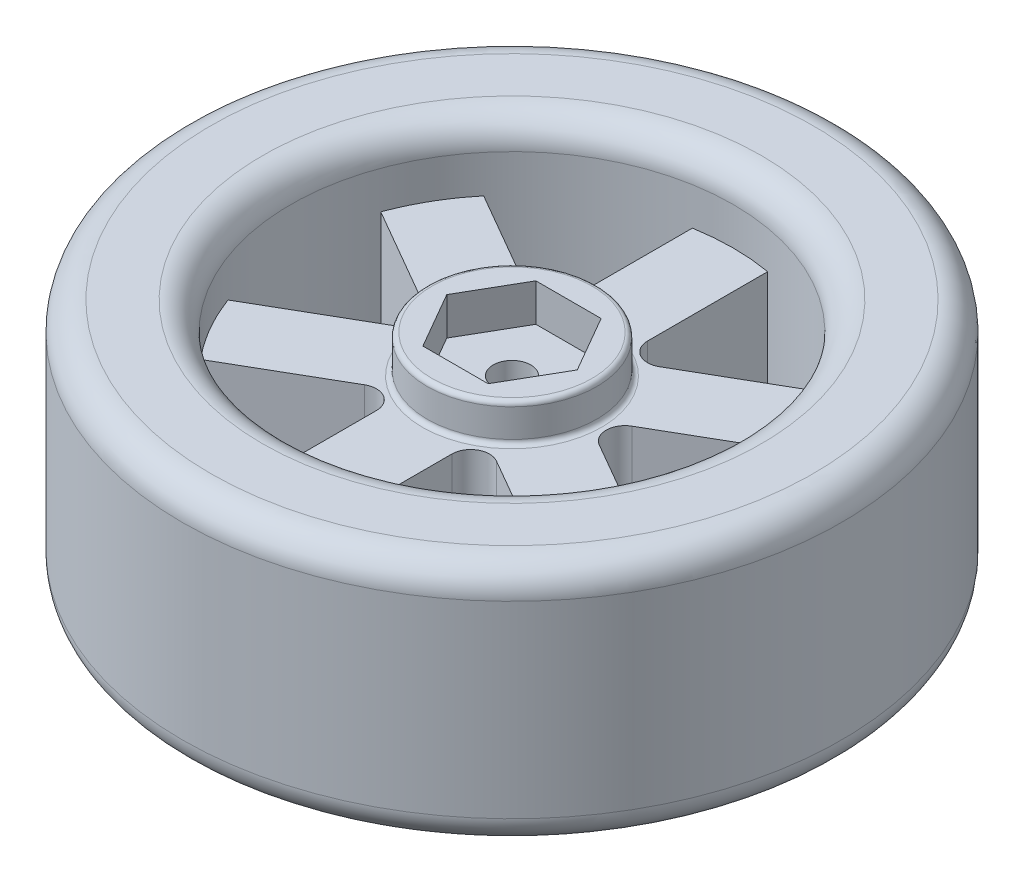
from build123d import *

# Parameters (mm, degrees)
EXTRUDE_1_DEPTH         = 19
SKETCH_2_R              = 35
SKETCH_2_R_2            = 23.501
EXTRUDE_2_DEPTH         = 26
SKETCH_3_R              = 9
EXTRUDE_3_DEPTH         = 4
SKETCH_4_R              = 2
CUT_EXTRUDE_1_DEPTH     = 54.018864567
CUT_EXTRUDE_2_OUTLINE_R = 2
CUT_EXTRUDE_2_DEPTH     = 3
FILLET_1_R              = 3
FILLET_2_R              = 2
FILLET_4_R              = 0.5


# Read off the part's stored shape, not the designer's step: 凸台-拉伸1, 切除-拉伸2
with BuildPart() as part:
    # 凸台-拉伸1 outline → 凸台-拉伸1 (new body)
    with BuildSketch(Plane(origin=(0, 0, 0), x_dir=(1, 0, 0), z_dir=(0, 1, 0))):
        with BuildLine():
            ThreePointArc((-22.052987429, -8.113836459), (-20.349816777, -11.749329428), (-18.052692611, -15.041869475))
            Line((-18.052692611, -15.041869475), (-3.998719808, -6.927804495))
            Line((-3.998719808, -6.927804495), (-3.998719808, -23.155535764))
            ThreePointArc((-3.998719808, -23.155535764), (0.001294785, -23.498293197), (4.001280192, -23.155195337))
            Line((4.001280192, -23.155195337), (4.001280192, -6.927065376))
            Line((4.001280192, -6.927065376), (18.054907717, -15.04093101))
            ThreePointArc((18.054907717, -15.04093101), (20.351751657, -11.748195474), (22.054612898, -8.112557567))
            Line((22.054612898, -8.112557567), (8.000640096, 0.001507414))
            Line((8.000640096, 0.001507414), (22.054267621, 8.115373049))
            ThreePointArc((22.054267621, 8.115373049), (20.351096969, 11.750866018), (18.053972802, 15.043406065))
            Line((18.053972802, 15.043406065), (4, 6.929341085))
            Line((4, 6.929341085), (4, 23.157072354))
            ThreePointArc((4, 23.157072354), (-1.4593e-05, 23.499829787), (-4, 23.156731927))
            Line((-4, 23.156731927), (-4, 6.928601966))
            Line((-4, 6.928601966), (-18.053627525, 15.0424676))
            ThreePointArc((-18.053627525, 15.0424676), (-20.350471465, 11.749732064), (-22.053332706, 8.114094157))
            Line((-22.053332706, 8.114094157), (-7.999359904, 2.9176e-05))
            Line((-7.999359904, 2.9176e-05), (-22.052987429, -8.113836459))
        make_face()
    extrude(amount=EXTRUDE_1_DEPTH)

    # 草图3 → 凸台-拉伸3 (add)
    with BuildSketch(Plane(origin=(0, 19, 0), x_dir=(1, 0, 0), z_dir=(0, 1, 0))):
        with Locations(Location((0, 0, 0), (0, 0, 63.612200039))):
            Circle(SKETCH_3_R)
        Polygon((3.464101615, -6), (6.92820323, 0), (3.464101615, 6), (-3.464101615, 6), (-6.92820323, 0), (-3.464101615, -6), align=None, mode=Mode.SUBTRACT)
    extrude(amount=EXTRUDE_3_DEPTH)

    # 草图4 → 切除-拉伸1 (cut, through all)
    with BuildSketch(Plane(origin=(0, 19, 0), x_dir=(1, 0, 0), z_dir=(0, 1, 0))):
        with Locations(Location((0, 0, 0), (0, 0, 270))):
            Circle(SKETCH_4_R)
    extrude(amount=-CUT_EXTRUDE_1_DEPTH, mode=Mode.SUBTRACT)

    # 切除-拉伸2 outline → 切除-拉伸2 (cut)
    with BuildSketch(Plane(origin=(0, 0, 0), x_dir=(1, 0, 0), z_dir=(0, 1, 0))):
        with BuildLine():
            ThreePointArc((-22.052987429, -8.113836459), (-20.349816777, -11.749329428), (-18.052692611, -15.041869475))
            Line((-18.052692611, -15.041869475), (-3.998719808, -6.927804495))
            Line((-3.998719808, -6.927804495), (-3.998719808, -23.155535764))
            ThreePointArc((-3.998719808, -23.155535764), (0.001294785, -23.498293197), (4.001280192, -23.155195337))
            Line((4.001280192, -23.155195337), (4.001280192, -6.927065376))
            Line((4.001280192, -6.927065376), (18.054907717, -15.04093101))
            ThreePointArc((18.054907717, -15.04093101), (20.351751657, -11.748195474), (22.054612898, -8.112557567))
            Line((22.054612898, -8.112557567), (8.000640096, 0.001507414))
            Line((8.000640096, 0.001507414), (22.054267621, 8.115373049))
            ThreePointArc((22.054267621, 8.115373049), (20.351096969, 11.750866018), (18.053972802, 15.043406065))
            Line((18.053972802, 15.043406065), (4, 6.929341085))
            Line((4, 6.929341085), (4, 23.157072354))
            ThreePointArc((4, 23.157072354), (-1.4593e-05, 23.499829787), (-4, 23.156731927))
            Line((-4, 23.156731927), (-4, 6.928601966))
            Line((-4, 6.928601966), (-18.053627525, 15.0424676))
            ThreePointArc((-18.053627525, 15.0424676), (-20.350471465, 11.749732064), (-22.053332706, 8.114094157))
            Line((-22.053332706, 8.114094157), (-7.999359904, 2.9176e-05))
            Line((-7.999359904, 2.9176e-05), (-22.052987429, -8.113836459))
        make_face()
        Circle(CUT_EXTRUDE_2_OUTLINE_R, mode=Mode.SUBTRACT)
    extrude(amount=CUT_EXTRUDE_2_DEPTH, mode=Mode.SUBTRACT)

    # 圆角2
    # the kernel refuses this fillet: 2 mm, written as the material it adds along each edge
    with BuildSketch(Plane(origin=(-4, 3, -6.928601966), x_dir=(-0.8660254038017692, 0, -0.4999999999699828), z_dir=(0, 1, 0)), Plane(origin=(4, 3, -6.929341085), x_dir=(0, 0, -1), z_dir=(0, 1, 0)), Plane(origin=(8.000640096, 3, -0.001507414), x_dir=(0.8660254037750857, 0, -0.5000000000161998), z_dir=(0, 1, 0)), Plane(origin=(4.001280192, 3, 6.927065376), x_dir=(0.8660254038017693, 0, 0.4999999999699826), z_dir=(0, 1, 0)), Plane(origin=(-7.999359904, 3, -2.9176e-05), x_dir=(-0.8660254037750857, 0, 0.5000000000161998), z_dir=(0, 1, 0)), Plane(origin=(-3.998719808, 3, 6.927804495), x_dir=(0, 0, 1), z_dir=(0, 1, 0))) as fillet_2_piece_1:
        with BuildLine():
            CenterArc((FILLET_2_R * 1.7320508075, -FILLET_2_R), FILLET_2_R, 90, 119.999999998)
            Line((FILLET_2_R * 0.866025403698, -FILLET_2_R * 1.49999999997), (0, 0))
            Line((0, 0), (FILLET_2_R * 1.7320508075, 0))
        make_face()
    extrude(amount=16)

    # 圆角4
    fillet_4_edges = [part.edges().sort_by_distance(p)[0] for p in [
        (-4, 19, 8.062257748),
        (-4, 23, 8.062257748),
    ]]
    fillet(fillet_4_edges, radius=FILLET_4_R)


with BuildPart() as body_2:
    # 草图2 → 凸台-拉伸2 (new body)
    with BuildSketch(Plane(origin=(0, 0, 0), x_dir=(1, 0, 0), z_dir=(0, 1, 0))):
        with Locations(Location((0, 0, 0), (0, 0, 90))):
            Circle(SKETCH_2_R)
        with Locations(Location((0, 0, 0), (0, 0, 90))):
            Circle(SKETCH_2_R_2, mode=Mode.SUBTRACT)
    extrude(amount=EXTRUDE_2_DEPTH)

    # 圆角1
    fillet_1_edges = [body_2.edges().sort_by_distance(p)[0] for p in [
        (0, 0, 35),
        (0, 26, 35),
        (0, 0, 23.501),
        (0, 26, 23.501),
    ]]
    fillet(fillet_1_edges, radius=FILLET_1_R)


solid = Compound([part.part, body_2.part])
